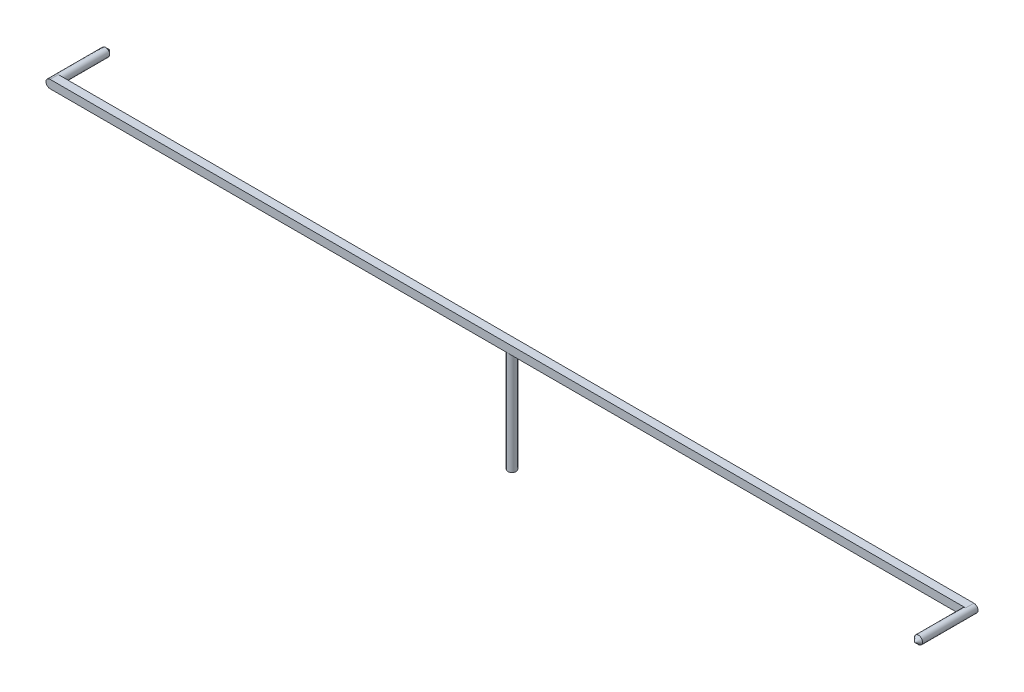
from build123d import *

# Parameters (mm, degrees)
SKETCH_1_R      = 0.4
EXTRUDE_1_DEPTH = 10
SKETCH_2_W      = 90
SKETCH_2_H      = 0.8
EXTRUDE_2_DEPTH = 0.8
FILLET_1_R      = 0.4
SKETCH_3_R      = 0.4
EXTRUDE_3_DEPTH = 5
SKETCH_4_R      = 0.4
EXTRUDE_4_DEPTH = 5
CHAMFER_1_SIZE  = 0.4


with BuildPart() as part:
    # 草图1 → 凸台-拉伸1 (new body)
    with BuildSketch(Plane(origin=(0, 0, 0), x_dir=(1, 0, 0), z_dir=(0, 1, 0))):
        with Locations(Location((0, 0, 0), (0, 0, 270))):
            Circle(SKETCH_1_R)
    extrude(amount=EXTRUDE_1_DEPTH)

    # 草图2 → 凸台-拉伸2 (add)
    with BuildSketch(Plane(origin=(0, 10, 0), x_dir=(1, 0, 0), z_dir=(0, 1, 0))):
        Rectangle(SKETCH_2_W, SKETCH_2_H)
    extrude(amount=EXTRUDE_2_DEPTH)

    # 圆角1
    fillet_1_edges = [part.edges().sort_by_distance(p)[0] for p in [
        (45, 10, 0),
        (45, 10.8, 0),
        (-45, 10, 0),
        (-45, 10.8, 0),
    ]]
    fillet(fillet_1_edges, radius=FILLET_1_R - 0.0001)  # a hair under: the kernel refuses the full size

    # 草图3 → 凸台-拉伸3 (add)
    with BuildSketch(Plane.XY.offset(0.4)):
        with Locations((44.6, 10.4)):
            Circle(SKETCH_3_R)
    extrude(amount=EXTRUDE_3_DEPTH)

    # 草图4 → 凸台-拉伸4 (add)
    with BuildSketch(Plane(origin=(0, 0, -0.4), x_dir=(-1, 0, 0), z_dir=(0, 0, -1))):
        with Locations((44.6, 10.4)):
            Circle(SKETCH_4_R)
    extrude(amount=EXTRUDE_4_DEPTH)

    # 倒角1
    chamfer_1_edges = [part.edges().sort_by_distance(p)[0] for p in [
        (44.2, 10.4, 5.4),
        (-44.2, 10.4, -5.4),
    ]]
    chamfer(chamfer_1_edges, length=CHAMFER_1_SIZE)


solid = part.part
